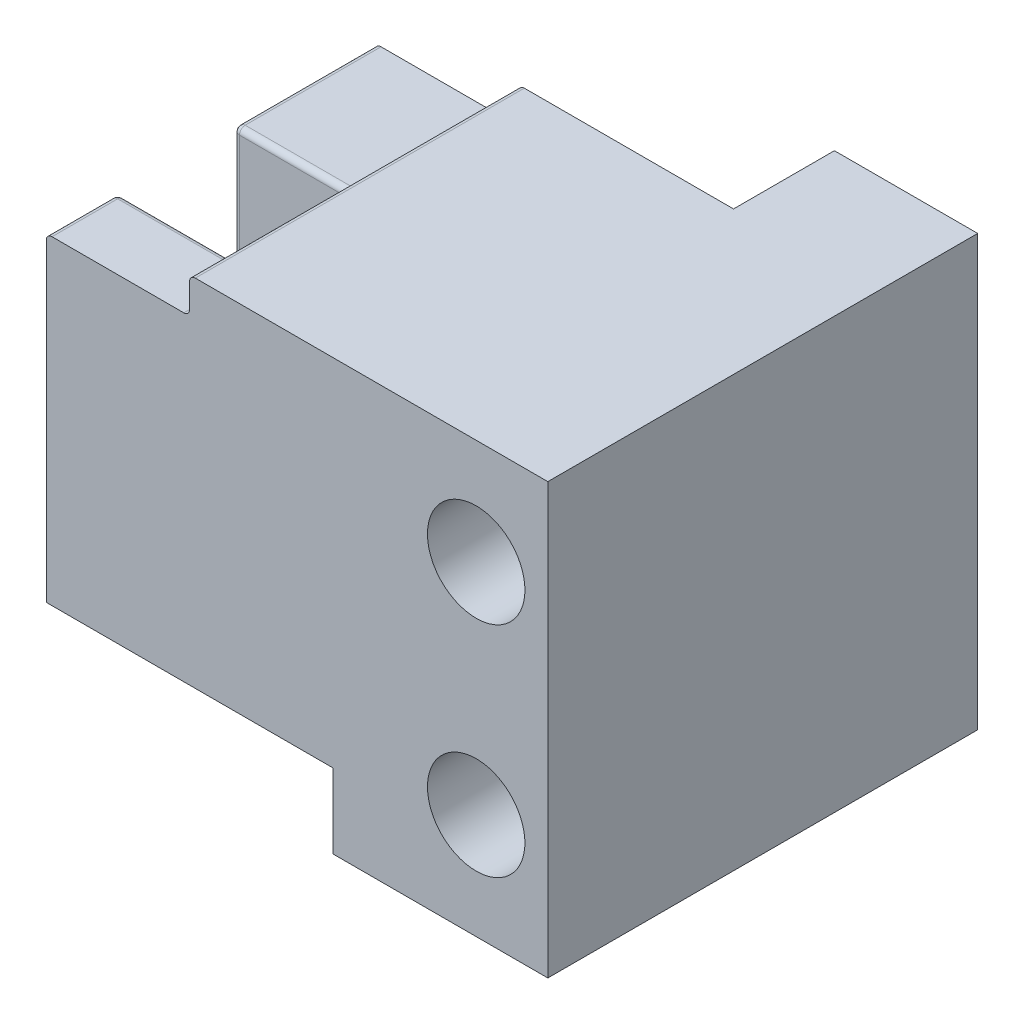
from build123d import *

# Parameters (mm, degrees)
SKETCH1_W           = 6.35
SKETCH1_H           = 19.05
SKETCH1_R           = 2.159
BOSS_EXTRUDE1_DEPTH = 19.05
SKETCH2_W           = 14.5796
SKETCH2_H           = 19.05
BOSS_EXTRUDE2_DEPTH = 19.05
SKETCH3_R           = 22.352
CUT_EXTRUDE1_DEPTH  = 2.57175
CUT_EXTRUDE2_REACH  = 34.996
SKETCH4_W           = 3.175
SKETCH4_H           = 19.05
CUT_EXTRUDE3_REACH  = 33.27
SKETCH6_W           = 6.35
SKETCH6_H           = 1.5875
FILLET2_R           = 0.254
FILLET3_START       = -15.6210001
FILLET3_DEPTH       = 5.918275981
FILLET3_START_2     = 9
FILLET3_2_DEPTH     = 8
CUT_EXTRUDE4_START  = -14.5796
CUT_EXTRUDE4_DEPTH  = 14.5796


with BuildPart() as part:
    # Sketch1 → Boss-Extrude1 (new body)
    with BuildSketch(Plane.XY):
        with Locations((3.175, 9.525)):
            Rectangle(SKETCH1_W, SKETCH1_H)
        with Locations(Location((3.175, 14.3764, 0), (0, 0, 180))):
            Circle(SKETCH1_R, mode=Mode.SUBTRACT)
        with Locations(Location((3.175, 4.6736, 0), (0, 0, 180))):
            Circle(SKETCH1_R, mode=Mode.SUBTRACT)
    extrude(amount=BOSS_EXTRUDE1_DEPTH)

    # Sketch2 → Boss-Extrude2 (add)
    with BuildSketch(Plane.ZY):
        with Locations((11.7602, 9.525)):
            Rectangle(SKETCH2_W, SKETCH2_H)
    extrude(amount=BOSS_EXTRUDE2_DEPTH)

    # Sketch3 → Cut-Extrude1 (cut, symmetric)
    with BuildSketch(Plane(origin=(0, 0, 13.31595), x_dir=(-1, 0, 0), z_dir=(0, 0, -1))):
        with Locations((31.4198, 9.525)):
            Circle(SKETCH3_R)
    extrude(amount=CUT_EXTRUDE1_DEPTH, both=True, mode=Mode.SUBTRACT)

    # Cut-Extrude2: up to this face of the body (flat: up to its plane)
    cut_extrude2_end = Plane(part.part.faces().sort_by_distance((3.175, 9.525, 0))[0])
    # Sketch4 → Cut-Extrude2 (cut, up to the picked face)
    with BuildSketch(Plane(origin=(0, 0, 19.05), x_dir=(-1, 0, 0), z_dir=(0, 0, -1)), mode=Mode.PRIVATE) as cut_extrude2_sk1:
        with Locations((17.4625, 9.525)):
            Rectangle(SKETCH4_W, SKETCH4_H)
    cut_extrude2_tool1 = split(extrude(cut_extrude2_sk1.sketch, amount=CUT_EXTRUDE2_REACH, mode=Mode.PRIVATE), bisect_by=cut_extrude2_end, keep=Keep.BOTH, mode=Mode.PRIVATE)
    add(cut_extrude2_tool1.solids().sort_by(Axis((-17.4625, 9.525, 19.05), (0, 0, -1)))[0], mode=Mode.SUBTRACT)

    # Sketch6 → Cut-Extrude3 (cut, up to next)
    with BuildSketch(Plane.XY.offset(19.05), mode=Mode.PRIVATE) as cut_extrude3_sk1:
        with Locations((-12.7, 0.79375)):
            Rectangle(SKETCH6_W, SKETCH6_H)
    cut_extrude3_tool1 = extrude(cut_extrude3_sk1.sketch, amount=-CUT_EXTRUDE3_REACH, mode=Mode.PRIVATE) & part.part
    # Sketch6 → Cut-Extrude3 (cut, up to next)
    with BuildSketch(Plane.XY.offset(19.05), mode=Mode.PRIVATE) as cut_extrude3_sk2:
        with Locations((-12.7, 18.25625)):
            Rectangle(SKETCH6_W, SKETCH6_H)
    cut_extrude3_tool2 = extrude(cut_extrude3_sk2.sketch, amount=-CUT_EXTRUDE3_REACH, mode=Mode.PRIVATE) & part.part
    add(cut_extrude3_tool1.solids().sort_by_distance((-12.7, 0.79375, 19.05))[0], mode=Mode.SUBTRACT)
    add(cut_extrude3_tool2.solids().sort_by_distance((-12.7, 18.25625, 19.05))[0], mode=Mode.SUBTRACT)

    # Fillet2
    fillet2_edges = [part.edges().sort_by_distance(p)[0] for p in [
        (-13.199816574, 1.5875, 10.7442),
        (-15.875, 1.5875, 7.6073),
        (-13.199816574, 1.5875, 15.8877),
        (-15.875, 1.5875, 17.46885),
        (-9.525, 1.5875, 11.7602),
        (-9.525, 0, 11.7602),
        (-13.199816574, 17.4625, 10.7442),
        (-9.525, 19.05, 11.7602),
        (-9.525, 17.4625, 11.7602),
        (-13.199816574, 17.4625, 15.8877),
        (-15.875, 17.4625, 7.6073),
        (-15.875, 17.4625, 17.46885),
        (-15.875, 9.525, 15.8877),
        (-15.875, 9.525, 10.7442),
    ]]
    fillet(fillet2_edges, radius=FILLET2_R)

    # Fillet3: read off the stored shape, not the designer's step
    # Fillet3 outline → Fillet3 (cut)
    with BuildSketch(Plane.YZ.offset(FILLET3_START)):
        with BuildLine():
            ThreePointArc((17.2085, 10.7442), (17.388105122, 10.669805122), (17.4625, 10.4902))
            Line((17.4625, 10.4902), (17.4625, 16.1417))
            ThreePointArc((17.4625, 16.1417), (17.388105122, 15.962094878), (17.2085, 15.8877))
            Line((17.2085, 15.8877), (1.8415, 15.8877))
            ThreePointArc((1.8415, 15.8877), (1.661894878, 15.962094878), (1.5875, 16.1417))
            Line((1.5875, 16.1417), (1.5875, 10.4902))
            ThreePointArc((1.5875, 10.4902), (1.661894878, 10.669805122), (1.8415, 10.7442))
            Line((1.8415, 10.7442), (17.2085, 10.7442))
        make_face()
    extrude(amount=FILLET3_DEPTH, mode=Mode.SUBTRACT)

    # Fillet3 2 outline → Fillet3 2 (add)
    with BuildSketch(Plane.XY.offset(FILLET3_START_2)):
        with BuildLine():
            ThreePointArc((-9.702724219, 4.235338054), (-9.880467378, 2.915439177), (-9.778999483, 1.587497181))
            Line((-9.778999483, 1.587497181), (-9.702724119, 1.5875))
            Line((-9.702724119, 1.5875), (-9.702724219, 4.235338054))
        make_face()
        with BuildLine():
            Line((-9.702724119, 17.4625), (-9.778999483, 17.462502819))
            ThreePointArc((-9.778999483, 17.462502819), (-9.880467378, 16.134560823), (-9.702724219, 14.814661946))
            Line((-9.702724219, 14.814661946), (-9.702724119, 17.4625))
        make_face()
    extrude(amount=FILLET3_2_DEPTH)

    # Cut-Extrude4: read off the stored shape, not the designer's step
    # Cut-Extrude4 outline → Cut-Extrude4 (cut)
    with BuildSketch(Plane.XY.offset(19.05).offset(CUT_EXTRUDE4_START)):
        with BuildLine():
            Line((-9.271, 0), (-3.175, 0))
            Line((-3.175, 0), (-3.175, 3.302))
            Line((-3.175, 3.302), (-9.857519432, 3.302))
            ThreePointArc((-9.857519432, 3.302), (-9.876451593, 2.442083536), (-9.778999483, 1.587497181))
            ThreePointArc((-9.778999483, 1.587497181), (-9.599394878, 1.513105122), (-9.525, 1.3335))
            Line((-9.525, 1.3335), (-9.525, 0.254))
            ThreePointArc((-9.525, 0.254), (-9.450605122, 0.074394878), (-9.271, 0))
        make_face()
        with BuildLine():
            ThreePointArc((-9.778999483, 1.587497181), (-9.876451593, 2.442083536), (-9.857519432, 3.302))
            Line((-9.857519432, 3.302), (-15.875, 3.302))
            Line((-15.875, 3.302), (-15.875, 1.8415))
            ThreePointArc((-15.875, 1.8415), (-15.800605122, 1.661894878), (-15.621, 1.5875))
            Line((-15.621, 1.5875), (-9.778999483, 1.587497181))
        make_face()
    extrude(amount=CUT_EXTRUDE4_DEPTH, mode=Mode.SUBTRACT)


solid = part.part
